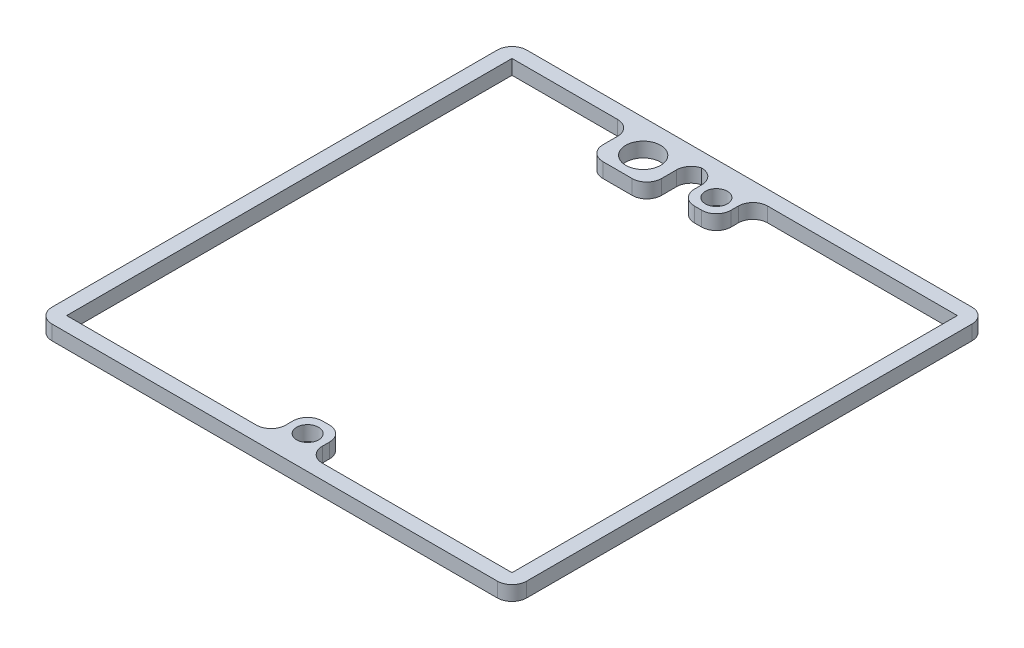
from build123d import *

# Parameters (mm, degrees)
SKETCH1_W           = 64.85
SKETCH1_H           = 64.85
SKETCH1_W_2         = 60.85
SKETCH1_H_2         = 60.85
BOSS_EXTRUDE1_DEPTH = 2
SKETCH2_W           = 5
SKETCH2_H           = 5
SKETCH2_R           = 1.5
BOSS_EXTRUDE2_DEPTH = 2
FILLET1_R           = 2
SKETCH3_W           = 8
SKETCH3_H           = 6
SKETCH3_R           = 2.38125
BOSS_EXTRUDE3_DEPTH = 2
FILLET2_R           = 2


with BuildPart() as part:
    # Sketch1 → Boss-Extrude1 (new body)
    with BuildSketch(Plane(origin=(0, 0, 0), x_dir=(1, 0, 0), z_dir=(0, 1, 0))):
        Rectangle(SKETCH1_W, SKETCH1_H)
        Rectangle(SKETCH1_W_2, SKETCH1_H_2, mode=Mode.SUBTRACT)
    extrude(amount=BOSS_EXTRUDE1_DEPTH)

    # Sketch2 → Boss-Extrude2 (add)
    # profile 1 of 2: a face of its own
    with BuildSketch(Plane(origin=(0, 2, 0), x_dir=(1, 0, 0), z_dir=(0, 1, 0))):
        with Locations((0, 27.925)):
            Rectangle(SKETCH2_W, SKETCH2_H)
        with Locations(Location((0, 27.925, 0), (0, 0, 270))):
            Circle(SKETCH2_R, mode=Mode.SUBTRACT)
    # profile 2 of 2: a face of its own
    with BuildSketch(Plane(origin=(0, 2, 0), x_dir=(1, 0, 0), z_dir=(0, 1, 0))):
        with Locations((0, -27.925)):
            Rectangle(SKETCH2_W, SKETCH2_H)
        with Locations(Location((0, -27.925, 0), (0, 0, 270))):
            Circle(SKETCH2_R, mode=Mode.SUBTRACT)
    extrude(amount=-BOSS_EXTRUDE2_DEPTH)

    # Fillet1
    fillet1_edges = [part.edges().sort_by_distance(p)[0] for p in [
        (32.425, 1, 32.425),
        (-32.425, 1, 32.425),
        (32.425, 1, -32.425),
        (-32.425, 1, -32.425),
        (2.5, 1, -30.425),
        (-2.5, 1, -30.425),
        (-2.5, 1, 30.425),
        (2.5, 1, 30.425),
        (2.5, 1, -25.425),
        (-2.5, 1, -25.425),
        (-2.5, 1, 25.425),
        (2.5, 1, 25.425),
    ]]
    fillet(fillet1_edges, radius=FILLET1_R)

    # Sketch3 → Boss-Extrude3 (add)
    with BuildSketch(Plane(origin=(0, 2, 0), x_dir=(1, 0, 0), z_dir=(0, 1, 0))):
        with Locations((-10, 27.425)):
            Rectangle(SKETCH3_W, SKETCH3_H)
        with Locations(Location((-10, 27.925, 0), (0, 0, 270))):
            Circle(SKETCH3_R, mode=Mode.SUBTRACT)
    extrude(amount=-BOSS_EXTRUDE3_DEPTH)

    # Fillet2
    # the kernel refuses this fillet: 2 mm, written as the material it adds along each edge
    with BuildSketch(Plane(origin=(-14, 2, -30.425), x_dir=(-1, 0, 0), z_dir=(0, -1, 0))) as fillet2_piece_1:
        with BuildLine():
            CenterArc((FILLET2_R, -FILLET2_R), FILLET2_R, 90, 90)
            Line((0, -FILLET2_R), (0, 0))
            Line((0, 0), (FILLET2_R, 0))
        make_face()
    extrude(amount=2)
    with BuildSketch(Plane(origin=(-6, 2, -30.425), x_dir=(1, 0, 0), z_dir=(0, -1, 0))) as fillet2_piece_2:
        with BuildLine():
            CenterArc((2, 1.936491673), FILLET2_R, 180, 75.522487814)
            Line((0, 1.936491673), (0, 0))
            Line((0, 0), (1.5, 0))
        make_face()
    extrude(amount=2)
    # the kernel refuses this fillet: 2 mm, written as the material it takes off along each edge
    with BuildSketch(Plane(origin=(-14, 7, -24.425), x_dir=(1, 0, 0), z_dir=(0, -1, 0)), Plane(origin=(-6, 7, -24.425), x_dir=(0, 0, -1), z_dir=(0, -1, 0))) as fillet2_2_piece_1:
        with BuildLine():
            CenterArc((FILLET2_R, -FILLET2_R), FILLET2_R, 90, 90)
            Line((0, -FILLET2_R), (0, 0))
            Line((0, 0), (FILLET2_R, 0))
        make_face()
    extrude(amount=12, mode=Mode.SUBTRACT)


solid = part.part
